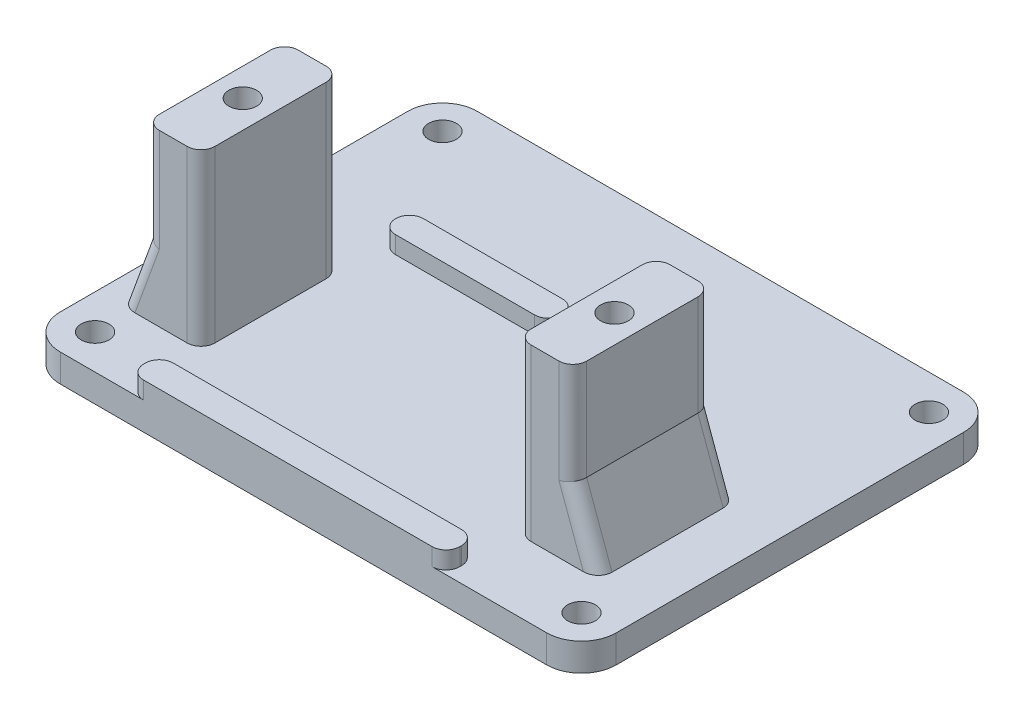
from build123d import *
from OCP.BRepFilletAPI import BRepFilletAPI_MakeChamfer

# Parameters (mm, degrees)
SKETCH_1_W          = 80
SKETCH_1_H          = 60
SKETCH_1_R          = 2
EXTRUDE_1_DEPTH     = 4
FILLET_1_R          = 5
SKETCH_2_W          = 24
SKETCH_2_H          = 4
SKETCH_2_W_2        = 45.5
SKETCH_2_H_2        = 4.25
EXTRUDE_2_DEPTH     = 2.5
EXTRUDE_3_DEPTH     = 24.5
SKETCH_3_R          = 2
CUT_EXTRUDE_1_DEPTH = 7
CHAMFER_1_SIZE      = 10
CHAMFER_1_SIZE2     = 3.639702343
FILLET_2_R          = 2
FILLET_3_R          = 2
FILLET_4_R          = 2


with BuildPart() as part:
    # Эскиз1 → Бобышка-Вытянуть1 (new body)
    with BuildSketch(Plane(origin=(0, 0, 0), x_dir=(1, 0, 0), z_dir=(0, 1, 0))):
        Rectangle(SKETCH_1_W, SKETCH_1_H)
        with Locations(Location((-35, 25, 0), (0, 0, 270))):
            Circle(SKETCH_1_R, mode=Mode.SUBTRACT)
        with Locations(Location((35, 25, 0), (0, 0, 270))):
            Circle(SKETCH_1_R, mode=Mode.SUBTRACT)
        with Locations(Location((-35, -25, 0), (0, 0, 270))):
            Circle(SKETCH_1_R, mode=Mode.SUBTRACT)
        with Locations(Location((35, -25, 0), (0, 0, 270))):
            Circle(SKETCH_1_R, mode=Mode.SUBTRACT)
    extrude(amount=EXTRUDE_1_DEPTH)

    # Скругление1
    fillet_1_edges = [part.edges().sort_by_distance(p)[0] for p in [
        (40, 2, 30),
        (-40, 2, 30),
        (-40, 2, -30),
        (40, 2, -30),
    ]]
    fillet(fillet_1_edges, radius=FILLET_1_R)

    # Эскиз2 → Бобышка-Вытянуть2 (add)
    with BuildSketch(Plane(origin=(0, 4, 0), x_dir=(1, 0, 0), z_dir=(0, 1, 0))):
        with Locations((-13, 8.25)):
            Rectangle(SKETCH_2_W, SKETCH_2_H)
        with Locations((-2.25, -27.875)):
            Rectangle(SKETCH_2_W_2, SKETCH_2_H_2)
    extrude(amount=EXTRUDE_2_DEPTH)

    # Эскиз2<3> → Бобышка-Вытянуть3 (add)
    with BuildSketch(Plane(origin=(0, 4, 0), x_dir=(1, 0, 0), z_dir=(0, 1, 0))):
        Polygon((20.5, -19.75), (20.5, -9.75), (20.5, 0.25), (28.5, 0.25), (28.5, -19.75), align=None)
        Polygon((-25, -19.75), (-25, -9.75), (-25, 0.25), (-33, 0.25), (-33, -19.75), align=None)
    extrude(amount=EXTRUDE_3_DEPTH)

    # Эскиз3 → Вырез-Вытянуть1 (cut)
    with BuildSketch(Plane(origin=(0, 28.5, 0), x_dir=(1, 0, 0), z_dir=(0, 1, 0))):
        with Locations(Location((-29, -9.75, 0), (0, 0, 270))):
            Circle(SKETCH_3_R)
        with Locations(Location((24.5, -9.75, 0), (0, 0, 270))):
            Circle(SKETCH_3_R)
    extrude(amount=-CUT_EXTRUDE_1_DEPTH, mode=Mode.SUBTRACT)

    # Фаска1: one chamfer whose edges measure the first distance from different faces: ONE call of the kernel's chamfer builder (chamfer() names one face for all edges)
    chamfer_1_edges_1 = [part.edges().sort_by_distance(p)[0] for p in [
        (28.5, 4, 9.75),
    ]]
    chamfer_1_side_1 = [part.faces().sort_by_distance(p)[0] for p in [
        (28.5, 16.25, 9.75),
    ]]
    chamfer_1_edges_2 = [part.edges().sort_by_distance(p)[0] for p in [
        (-33, 4, 9.75),
    ]]
    chamfer_1_side_2 = [part.faces().sort_by_distance(p)[0] for p in [
        (-33, 16.25, 9.75),
    ]]
    chamfer_1 = BRepFilletAPI_MakeChamfer(part.part.solid().wrapped)
    for e in chamfer_1_edges_1:
        chamfer_1.Add(CHAMFER_1_SIZE, CHAMFER_1_SIZE2, e.wrapped, chamfer_1_side_1[0].wrapped)  # the first distance lies on this face
    for e in chamfer_1_edges_2:
        chamfer_1.Add(CHAMFER_1_SIZE, CHAMFER_1_SIZE2, e.wrapped, chamfer_1_side_2[0].wrapped)  # the first distance lies on this face
    add(Compound.cast(chamfer_1.Shape()), mode=Mode.REPLACE)

    # Скругление2
    fillet_2_edges = [part.edges().sort_by_distance(p)[0] for p in [
        (-34.819851171, 9, 19.75),
        (-34.819851171, 9, -0.25),
        (30.319851171, 9, 19.75),
        (30.319851171, 9, -0.25),
        (20.5, 16.25, -0.25),
        (20.5, 16.25, 19.75),
        (-25, 16.25, 19.75),
        (-25, 16.25, -0.25),
    ]]
    fillet(fillet_2_edges, radius=FILLET_2_R)

    # Скругление3
    fillet_3_edges = [part.edges().sort_by_distance(p)[0] for p in [
        (-25, 5.25, -6.25),
        (-1, 5.25, -10.25),
        (-25, 5.25, -10.25),
        (-1, 5.25, -6.25),
        (20.5, 5.25, 25.75),
        (20.5, 5.25, 30),
        (-25, 5.25, 30),
        (-25, 5.25, 25.75),
    ]]
    fillet(fillet_3_edges, radius=FILLET_3_R - 0.0001)  # a hair under: the kernel refuses the full size

    # Скругление4
    fillet_4_edges = [part.edges().sort_by_distance(p)[0] for p in [
        (28.5, 18.3261956, -0.25),
        (28.5, 18.3261956, 19.75),
        (-33, 18.3261956, -0.25),
        (-33, 18.3261956, 19.75),
    ]]
    fillet(fillet_4_edges, radius=FILLET_4_R)


solid = part.part
